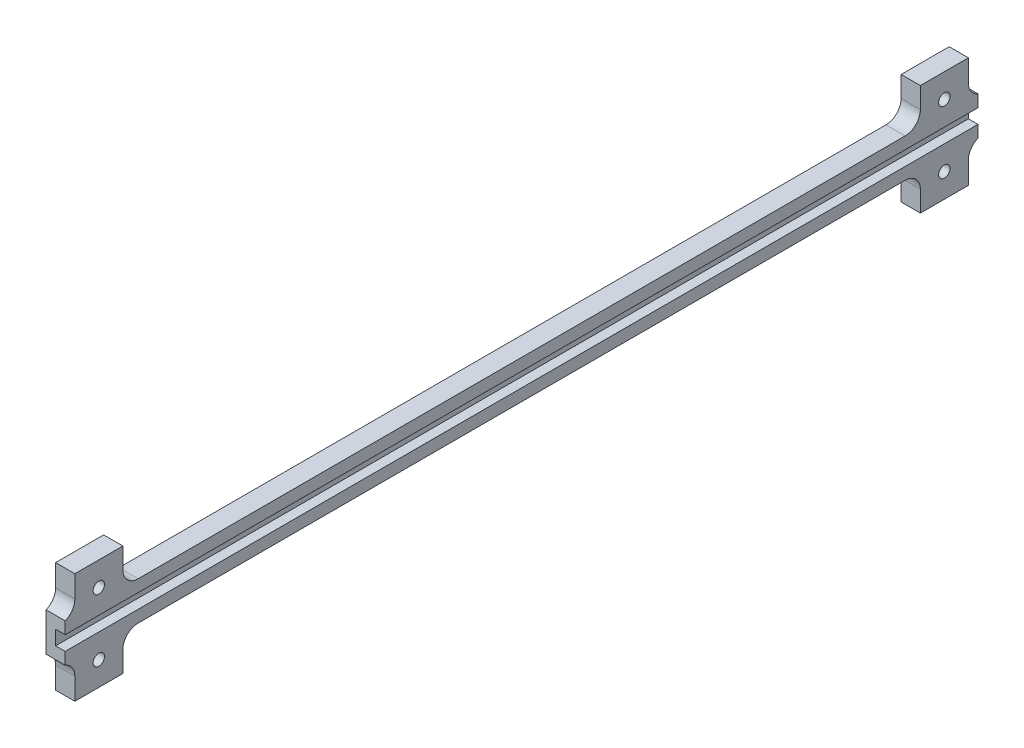
from build123d import *

# Parameters (mm, degrees)
BOSS_EXTRUDE1_DEPTH       = 95
SKETCH4_W                 = 5
SKETCH4_H                 = 5
BOSS_EXTRUDE4_DEPTH       = 2
FILLET1_R                 = 1.5875
F_0_80_TAPPED_HOLE1_D     = 1.19126
F_0_80_TAPPED_HOLE1_DEPTH = 4.0005
F_0_80_TAPPED_HOLE1_TIP   = 0.357890611


with BuildPart() as part:
    # Sketch1 → Boss-Extrude1 (new body)
    with BuildSketch(Plane.XY):
        Polygon((-1, 2), (-1, -2), (1, -2), (1, -0.75), (0, -0.75), (0, 0.75), (1, 0.75), (1, 2), align=None)
    extrude(amount=BOSS_EXTRUDE1_DEPTH)

    # Sketch4 → Boss-Extrude4 (add)
    with BuildSketch(Plane(origin=(1, 0, 0), x_dir=(0, 0, -1), z_dir=(1, 0, 0))):
        with Locations((-91.5, 3.25)):
            Rectangle(SKETCH4_W, SKETCH4_H)
        with Locations((-91.5, -3.25)):
            Rectangle(SKETCH4_W, SKETCH4_H)
        with Locations((-3.5, 3.25)):
            Rectangle(SKETCH4_W, SKETCH4_H)
        with Locations((-3.5, -3.25)):
            Rectangle(SKETCH4_W, SKETCH4_H)
    extrude(amount=-BOSS_EXTRUDE4_DEPTH)

    # Fillet1
    # the kernel refuses this fillet: 1.5875 mm, written as the material it adds along each edge
    with BuildSketch(Plane(origin=(1, 2, 94), x_dir=(0, 0, 1), z_dir=(-1, 0, 0))) as fillet1_piece_1:
        with BuildLine():
            CenterArc((1.5875, 1.47478812), FILLET1_R, 180, 68.279526527)
            Line((0, 1.47478812), (-0.03175, 1.47478812))
            Line((-0.03175, 1.47478812), (-0.03175, 0))
            Line((-0.03175, 0), (0, -0.03175))
            ThreePointArc((0, -0.03175), (0.5, -0.03175), (0.98825, -0.029495762))
            Line((0.98825, -0.029495762), (1, 0))
        make_face()
    extrude(amount=2)
    with BuildSketch(Plane(origin=(-1, 2, 89), x_dir=(0, 1, 0), z_dir=(1, 0, 0)), Plane(origin=(-1, 2, 6), x_dir=(0, 0, 1), z_dir=(1, 0, 0))) as fillet1_piece_2:
        with BuildLine():
            CenterArc((FILLET1_R, -FILLET1_R), FILLET1_R, 90, 90)
            Line((0, -FILLET1_R), (-FILLET1_R * 0.02, -FILLET1_R))
            Line((-FILLET1_R * 0.02, -FILLET1_R), (-FILLET1_R * 0.02, FILLET1_R * 0.02))
            Line((-FILLET1_R * 0.02, FILLET1_R * 0.02), (FILLET1_R, FILLET1_R * 0.02))
            Line((FILLET1_R, FILLET1_R * 0.02), (FILLET1_R, 0))
        make_face()
    extrude(amount=2)
    with BuildSketch(Plane(origin=(1, 2, 1), x_dir=(0, 1, 0), z_dir=(-1, 0, 0))) as fillet1_piece_3:
        with BuildLine():
            CenterArc((1.47478812, 1.5875), FILLET1_R, 201.720473473, 68.279526527)
            Line((0, 1), (-0.029495762, 0.98825))
            ThreePointArc((-0.029495762, 0.98825), (-0.03175, 0.5), (-0.03175, 0))
            Line((-0.03175, 0), (0, -0.03175))
            Line((0, -0.03175), (1.47478812, -0.03175))
            Line((1.47478812, -0.03175), (1.47478812, 0))
        make_face()
    extrude(amount=2)
    with BuildSketch(Plane(origin=(1, -2, 6), x_dir=(0, -1, 0), z_dir=(-1, 0, 0)), Plane(origin=(1, -2, 89), x_dir=(0, 0, -1), z_dir=(-1, 0, 0))) as fillet1_piece_4:
        with BuildLine():
            CenterArc((FILLET1_R, FILLET1_R), FILLET1_R, 180, 90)
            Line((0, FILLET1_R), (-FILLET1_R * 0.02, FILLET1_R))
            Line((-FILLET1_R * 0.02, FILLET1_R), (-FILLET1_R * 0.02, -FILLET1_R * 0.02))
            Line((-FILLET1_R * 0.02, -FILLET1_R * 0.02), (FILLET1_R, -FILLET1_R * 0.02))
            Line((FILLET1_R, -FILLET1_R * 0.02), (FILLET1_R, 0))
        make_face()
    extrude(amount=2)
    with BuildSketch(Plane(origin=(-1, -2, 1), x_dir=(0, 0, -1), z_dir=(1, 0, 0))) as fillet1_piece_5:
        with BuildLine():
            CenterArc((1.5875, -1.47478812), FILLET1_R, 111.720473473, 68.279526527)
            Line((0, -1.47478812), (-0.03175, -1.47478812))
            Line((-0.03175, -1.47478812), (-0.03175, 0))
            Line((-0.03175, 0), (0, 0.03175))
            ThreePointArc((0, 0.03175), (0.5, 0.03175), (0.98825, 0.029495762))
            Line((0.98825, 0.029495762), (1, 0))
        make_face()
    extrude(amount=2)
    with BuildSketch(Plane(origin=(-1, -2, 94), x_dir=(0, -1, 0), z_dir=(1, 0, 0))) as fillet1_piece_6:
        with BuildLine():
            CenterArc((1.47478812, -1.5875), FILLET1_R, 90, 68.279526527)
            Line((0, -1), (-0.029495762, -0.98825))
            ThreePointArc((-0.029495762, -0.98825), (-0.03175, -0.5), (-0.03175, 0))
            Line((-0.03175, 0), (0, 0.03175))
            Line((0, 0.03175), (1.47478812, 0.03175))
            Line((1.47478812, 0.03175), (1.47478812, 0))
        make_face()
    extrude(amount=2)

    # #0-80 Tapped Hole1
    with Locations(Plane(origin=(1, 0, 0), x_dir=(0, 0, -1), z_dir=(1, 0, 0))):
        with Locations((-91.5, 3.25), (-3.5, -3.25), (-91.5, -3.25), (-3.5, 3.25)):
            Hole(F_0_80_TAPPED_HOLE1_D / 2, depth=F_0_80_TAPPED_HOLE1_DEPTH)
            with Locations((0, 0, -(F_0_80_TAPPED_HOLE1_DEPTH + F_0_80_TAPPED_HOLE1_TIP / 2))):  # 118° drill point
                Cone(0, F_0_80_TAPPED_HOLE1_D / 2, F_0_80_TAPPED_HOLE1_TIP, mode=Mode.SUBTRACT)


solid = part.part
